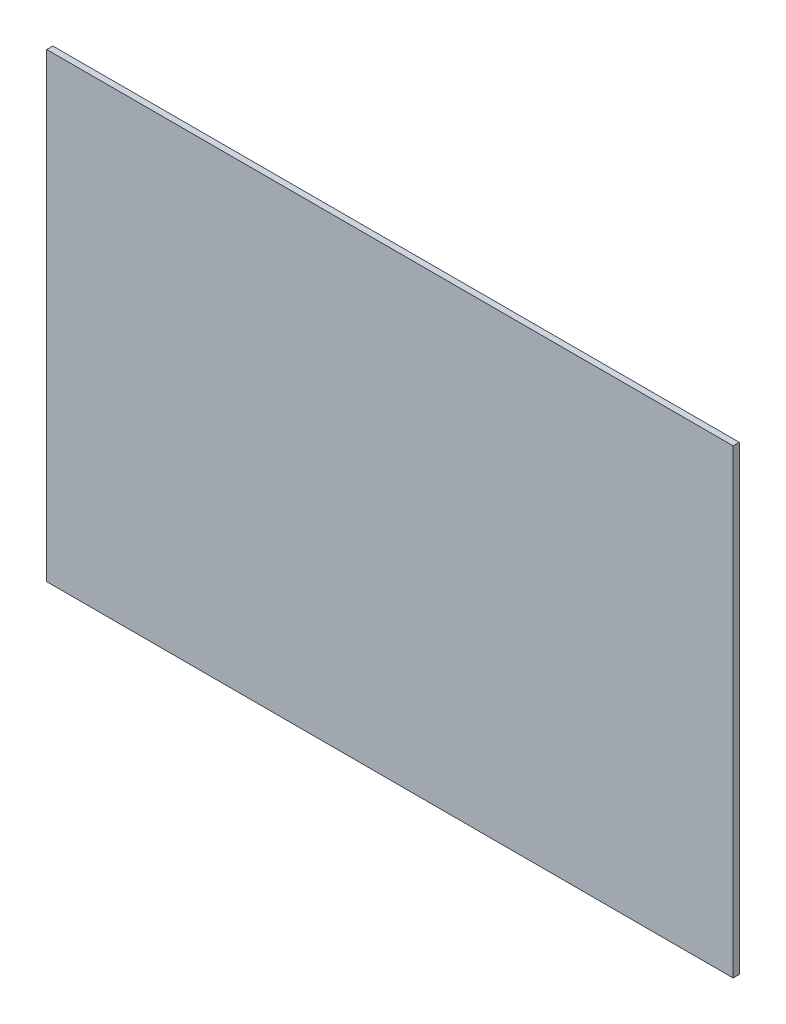
from build123d import *

# Parameters (mm, degrees)
SKETCH1_W           = 671.5125
SKETCH1_H           = 450.85
BOSS_EXTRUDE1_DEPTH = 3


with BuildPart() as part:
    # Sketch1 → Boss-Extrude1 (new, symmetric)
    with BuildSketch(Plane.XY):
        Rectangle(SKETCH1_W, SKETCH1_H)
    extrude(amount=BOSS_EXTRUDE1_DEPTH, both=True)


solid = part.part
